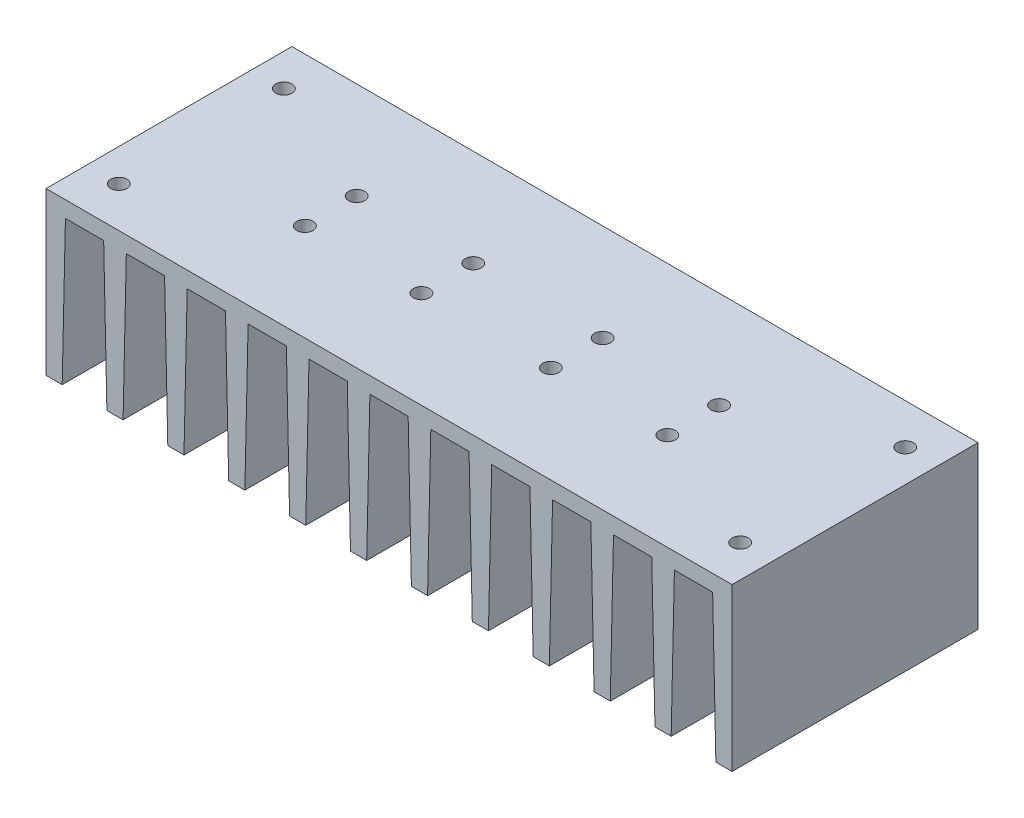
from build123d import *

# Parameters (mm, degrees)
SKETCH1_W           = 212
SKETCH1_H           = 76
BOSS_EXTRUDE1_DEPTH = 50
CUT_EXTRUDE1_DEPTH  = 77
SKETCH4_R           = 2.5
CUT_EXTRUDE2_DEPTH  = 77


with BuildPart() as part:
    # Sketch1 → Boss-Extrude1 (new body)
    with BuildSketch(Plane(origin=(0, 0, 0), x_dir=(1, 0, 0), z_dir=(0, 1, 0))):
        Rectangle(SKETCH1_W, SKETCH1_H)
    extrude(amount=BOSS_EXTRUDE1_DEPTH)

    # Sketch2 → Cut-Extrude1 (cut)
    with BuildSketch(Plane.XY.offset(38)):
        Polygon((101, 0), (100, 45), (88.181819, 45), (87.181819, 0), align=None)
        Polygon((68.363638, 0), (82.181819, 0), (81.181819, 45), (69.363638, 45), align=None)
        Polygon((49.545457, 0), (63.363638, 0), (62.363638, 45), (50.545457, 45), align=None)
        Polygon((30.727276, 0), (44.545457, 0), (43.545457, 45), (31.727276, 45), align=None)
        Polygon((11.909095, 0), (25.727276, 0), (24.727276, 45), (12.909095, 45), align=None)
        Polygon((-6.909086, 0), (6.909095, 0), (5.909095, 45), (-5.909086, 45), align=None)
        Polygon((-25.727267, 0), (-11.909086, 0), (-12.909086, 45), (-24.727267, 45), align=None)
        Polygon((-44.545448, 0), (-30.727267, 0), (-31.727267, 45), (-43.545448, 45), align=None)
        Polygon((-63.363629, 0), (-49.545448, 0), (-50.545448, 45), (-62.363629, 45), align=None)
        Polygon((-82.18181, 0), (-68.363629, 0), (-69.363629, 45), (-81.18181, 45), align=None)
        Polygon((-100.999991, 0), (-87.18181, 0), (-88.18181, 45), (-99.999991, 45), align=None)
    extrude(amount=-CUT_EXTRUDE1_DEPTH, mode=Mode.SUBTRACT)

    # Sketch4 → Cut-Extrude2 (cut)
    with BuildSketch(Plane(origin=(0, 50, 0), x_dir=(1, 0, 0), z_dir=(0, 1, 0))):
        with Locations((-96, 25.5)):
            Circle(SKETCH4_R)
        with Locations((-96, -25.5)):
            Circle(SKETCH4_R)
        with Locations((96, 25.5)):
            Circle(SKETCH4_R)
        with Locations((96, -25.5)):
            Circle(SKETCH4_R)
        with Locations((-56, 8)):
            Circle(SKETCH4_R)
        with Locations((-20, 8)):
            Circle(SKETCH4_R)
        with Locations((-20, -8)):
            Circle(SKETCH4_R)
        with Locations((-56, -8)):
            Circle(SKETCH4_R)
        with Locations((56, -8)):
            Circle(SKETCH4_R)
        with Locations((20, -8)):
            Circle(SKETCH4_R)
        with Locations((20, 8)):
            Circle(SKETCH4_R)
        with Locations((56, 8)):
            Circle(SKETCH4_R)
    extrude(amount=-CUT_EXTRUDE2_DEPTH, mode=Mode.SUBTRACT)


solid = part.part
